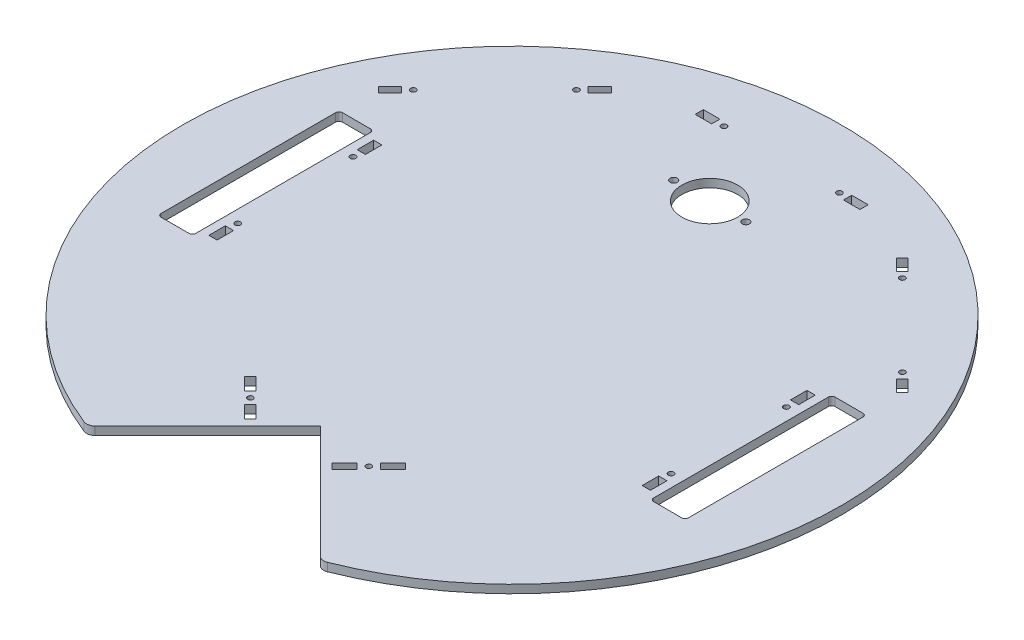
from build123d import *

# Parameters (mm, degrees)
SKETCH1_R           = 254
BOSS_EXTRUDE1_DEPTH = 6.35
CUT_EXTRUDE2_DEPTH  = 360.266367059
CUT_EXTRUDE4_DEPTH  = 360.266367059
SKETCH6_R           = 2.0955
CUT_EXTRUDE6_DEPTH  = 360.266367059
SKETCH8_R           = 2.1336
SKETCH8_W           = 6.35
SKETCH8_H           = 12.7
CUT_EXTRUDE7_DEPTH  = 360.266367059
FILLET1_R           = 6.35
SKETCH9_R           = 2.1336
SKETCH9_W           = 12.7
SKETCH9_H           = 6.35
CUT_EXTRUDE8_DEPTH  = 360.266367059
SKETCH10_R          = 2.1336
CUT_EXTRUDE9_DEPTH  = 360.266367059
SKETCH11_R          = 21.463
SKETCH11_R_2        = 2.778125
CUT_EXTRUDE10_DEPTH = 360.266367059


with BuildPart() as part:
    # Sketch1 → Boss-Extrude1 (new body)
    with BuildSketch(Plane(origin=(0, 0, 0), x_dir=(1, 0, 0), z_dir=(0, 1, 0))):
        Circle(SKETCH1_R)
    extrude(amount=BOSS_EXTRUDE1_DEPTH)

    # Sketch2 → Cut-Extrude2 (cut, through all)
    with BuildSketch(Plane(origin=(0, 6.35, 0), x_dir=(1, 0, 0), z_dir=(0, 1, 0))):
        with BuildLine():
            Line((0, -147.792682849), (-89.802561211, -237.59524406))
            ThreePointArc((-89.802561211, -237.59524406), (0, -254), (89.802561211, -237.59524406))
            Line((89.802561211, -237.59524406), (0, -147.792682849))
        make_face()
    extrude(amount=-CUT_EXTRUDE2_DEPTH, mode=Mode.SUBTRACT)

    # Sketch4 → Cut-Extrude4 (cut, through all)
    with BuildSketch(Plane(origin=(0, 6.35, 0), x_dir=(1, 0, 0), z_dir=(0, 1, 0))):
        with BuildLine():
            Line((-200.66, 69.85), (-179.07, 69.85))
            ThreePointArc((-179.07, 69.85), (-177.273948776, 69.106051224), (-176.53, 67.31))
            Line((-176.53, 67.31), (-176.53, -67.31))
            ThreePointArc((-176.53, -67.31), (-177.273948776, -69.106051224), (-179.07, -69.85))
            Line((-179.07, -69.85), (-200.66, -69.85))
            ThreePointArc((-200.66, -69.85), (-202.456051224, -69.106051224), (-203.2, -67.31))
            Line((-203.2, -67.31), (-203.2, 67.31))
            ThreePointArc((-203.2, 67.31), (-202.456051224, 69.106051224), (-200.66, 69.85))
        make_face()
    cut_extrude4 = extrude(amount=-CUT_EXTRUDE4_DEPTH, mode=Mode.SUBTRACT)

    # Mirror2: Cut-Extrude4 across plane
    add(cut_extrude4.mirror(Plane(origin=(0, 0, 0), x_dir=(0, 0, 1), z_dir=(1, 0, 0))), mode=Mode.SUBTRACT)

    # Sketch6 → Cut-Extrude6 (cut, through all)
    with BuildSketch(Plane(origin=(0, 6.35, 0), x_dir=(1, 0, 0), z_dir=(0, 1, 0))):
        with Locations((-45.653016486, -156.02120309)):
            Circle(SKETCH6_R)
        Polygon((-47.898080516, -149.286010999), (-57.630072518, -139.554018997), (-62.120200579, -144.044147058), (-52.388208577, -153.77613906), align=None)
        Polygon((-38.917824395, -158.26626712), (-29.185832393, -167.998259122), (-33.675960454, -172.488387182), (-43.407952456, -162.756395181), align=None)
    cut_extrude6 = extrude(amount=-CUT_EXTRUDE6_DEPTH, mode=Mode.SUBTRACT)

    # Mirror5: Cut-Extrude6 across plane
    add(cut_extrude6.mirror(Plane(origin=(0, 0, 0), x_dir=(0, 0, 1), z_dir=(1, 0, 0))), mode=Mode.SUBTRACT)

    # Sketch8 → Cut-Extrude7 (cut, through all)
    with BuildSketch(Plane.XZ):
        with Locations((-167.005, -44.45)):
            Circle(SKETCH8_R)
        with Locations((-167.005, 44.45)):
            Circle(SKETCH8_R)
        with Locations((-167.005, -57.15)):
            Rectangle(SKETCH8_W, SKETCH8_H)
        with Locations((-167.005, 57.15)):
            Rectangle(SKETCH8_W, SKETCH8_H)
    cut_extrude7 = extrude(amount=-CUT_EXTRUDE7_DEPTH, mode=Mode.SUBTRACT)

    # Mirror6: Cut-Extrude7 across plane
    add(cut_extrude7.mirror(Plane(origin=(0, 0, 0), x_dir=(0, 0, 1), z_dir=(1, 0, 0))), mode=Mode.SUBTRACT)

    # Fillet1
    fillet1_edges = [part.edges().sort_by_distance(p)[0] for p in [
        (89.802561211, 3.175, 237.59524406),
        (-89.802561211, 3.175, 237.59524406),
    ]]
    fillet(fillet1_edges, radius=FILLET1_R)

    # Sketch9 → Cut-Extrude8 (cut, through all)
    with BuildSketch(Plane.XZ):
        with Locations((-44.45, -207.81727558)):
            Circle(SKETCH9_R)
        with Locations((44.45, -207.81727558)):
            Circle(SKETCH9_R)
        with Locations((-57.15, -207.81727558)):
            Rectangle(SKETCH9_W, SKETCH9_H)
        with Locations((57.15, -207.81727558)):
            Rectangle(SKETCH9_W, SKETCH9_H)
    extrude(amount=-CUT_EXTRUDE8_DEPTH, mode=Mode.SUBTRACT)

    # Sketch10 → Cut-Extrude9 (cut, through all)
    with BuildSketch(Plane.XZ):
        with Locations((-188.470279928, -112.368300127)):
            Circle(SKETCH10_R)
        with Locations((-125.608487081, -175.230092975)):
            Circle(SKETCH10_R)
        Polygon((-204.18572814, -101.142979976), (-195.205472019, -110.123236097), (-190.715343959, -105.633108037), (-199.69560008, -96.652851915), align=None)
        Polygon((-123.363423051, -181.965285066), (-114.38316693, -190.945541187), (-109.893038869, -186.455413126), (-118.87329499, -177.475157005), align=None)
    cut_extrude9 = extrude(amount=-CUT_EXTRUDE9_DEPTH, mode=Mode.SUBTRACT)

    # Mirror7: Cut-Extrude9 across plane
    add(cut_extrude9.mirror(Plane(origin=(0, 0, 0), x_dir=(0, 0, 1), z_dir=(1, 0, 0))), mode=Mode.SUBTRACT)

    # Sketch11 → Cut-Extrude10 (cut, through all)
    with BuildSketch(Plane(origin=(0, 6.35, 0), x_dir=(1, 0, 0), z_dir=(0, 1, 0))):
        with Locations((0, 152.4)):
            Circle(SKETCH11_R)
        with Locations((27.78125, 152.4)):
            Circle(SKETCH11_R_2)
        with Locations((-27.78125, 152.4)):
            Circle(SKETCH11_R_2)
    extrude(amount=-CUT_EXTRUDE10_DEPTH, mode=Mode.SUBTRACT)


solid = part.part
